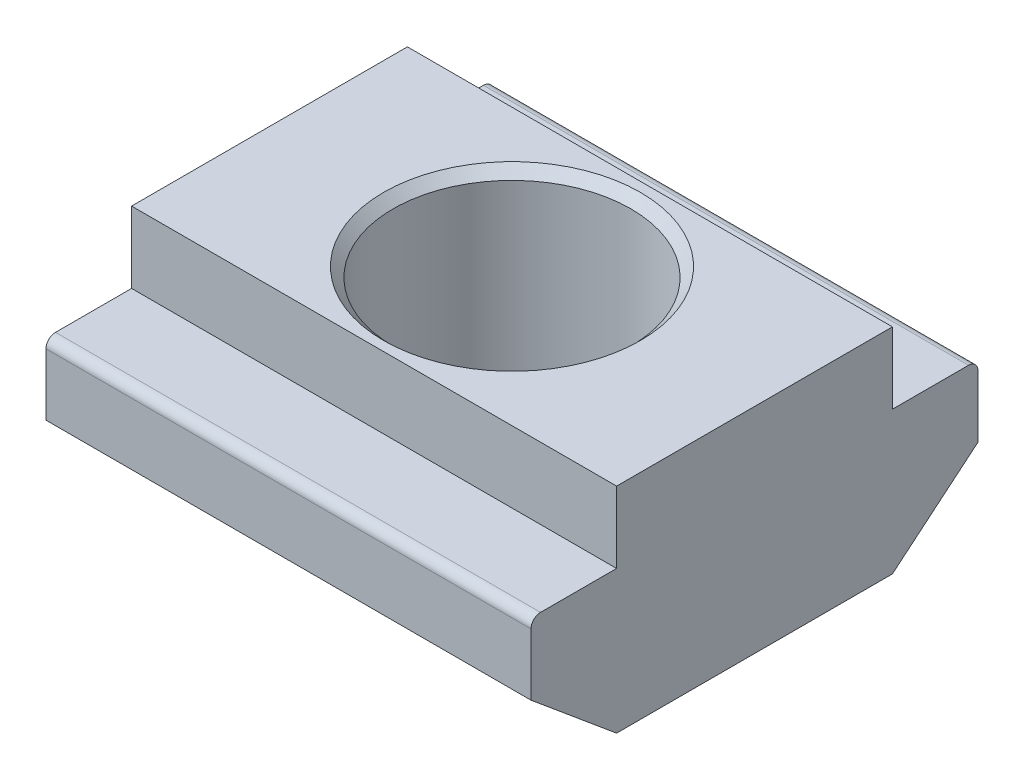
from build123d import *

# Parameters (mm, degrees)
BODY_DEPTH      = 10.2
SKETCH_2_R      = 2.5
SCREWHOLE_DEPTH = 10.2
CHAMFER_2_SIZE  = 0.2
FILLET_2_R      = 0.2


with BuildPart() as part:
    # Эскиз1 → Body (new body)
    with BuildSketch(Plane(origin=(0, 0, 0), x_dir=(0, 0, -1), z_dir=(1, 0, 0))):
        Polygon((-2.9, 0), (2.9, 0), (4.7, 1.5), (4.7, 3), (2.9, 3), (2.9, 4.5), (-2.9, 4.5), (-2.9, 3), (-4.7, 3), (-4.7, 1.5), align=None)
    extrude(amount=BODY_DEPTH)

    # Эскиз2 → screwHole (cut)
    with BuildSketch(Plane(origin=(0, 4.5, 0), x_dir=(1, 0, 0), z_dir=(0, 1, 0))):
        with Locations((5.1, 0)):
            Circle(SKETCH_2_R)
    extrude(amount=-SCREWHOLE_DEPTH, mode=Mode.SUBTRACT)

    # Chamfer 2
    chamfer_2_edges = [part.edges().sort_by_distance(p)[0] for p in [
        (2.6, 4.5, 0),
    ]]
    chamfer(chamfer_2_edges, length=CHAMFER_2_SIZE)

    # Fillet 2
    fillet_2_edges = [part.edges().sort_by_distance(p)[0] for p in [
        (5.1, 3, 4.7),
        (5.1, 3, -4.7),
    ]]
    fillet(fillet_2_edges, radius=FILLET_2_R)


solid = part.part
